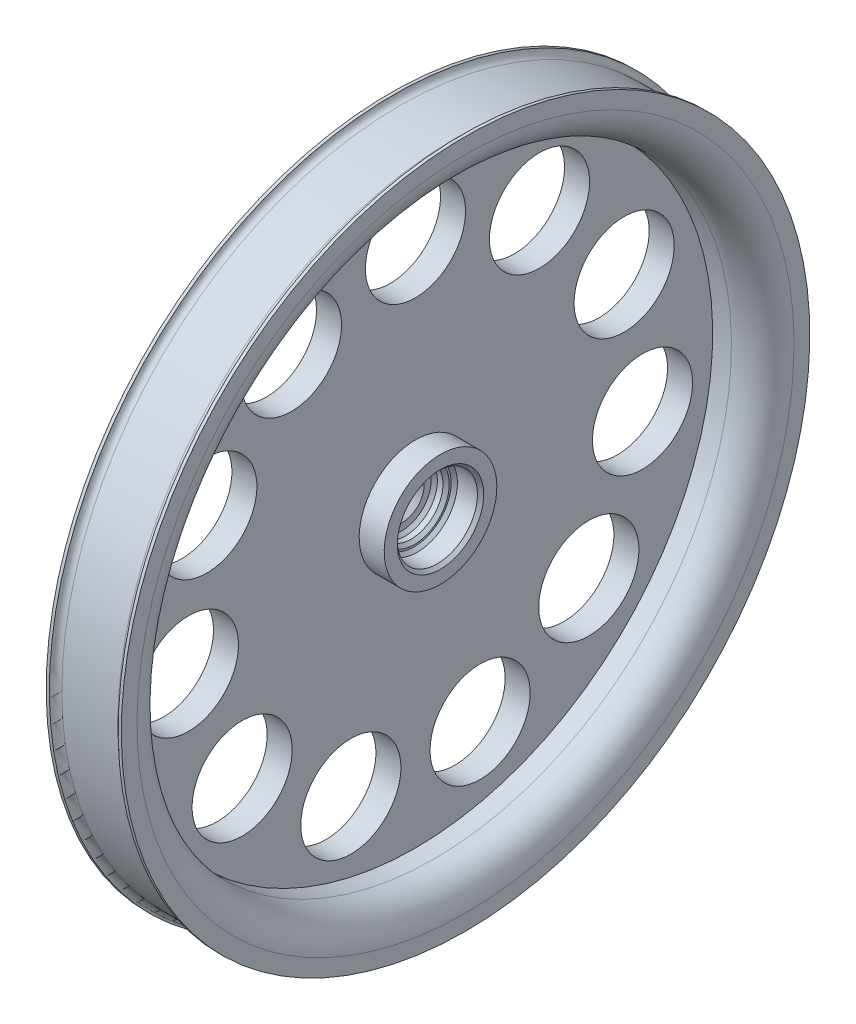
from build123d import *

# Parameters (mm, degrees)
SZKIC2_R                   = 2.5
WYTNIJ_WYCI_GNI_CIE1_DEPTH = 94.523218448
ZAOKR_GLENIE1_R            = 5
ZAOKR_GLENIE2_R            = 5
SFAZOWANIE1_SIZE           = 1
SFAZOWANIE2_SIZE           = 0.5
SFAZOWANIE3_SIZE           = 0.5
SZKIC3_R                   = 8
WYTNIJ_WYCI_GNI_CIE2_DEPTH = 93.122648621


with BuildPart() as part:
    # Szkic1 → Obrót1 (revolve)
    with BuildSketch(Plane.XY):
        with BuildLine():
            Line((0, 37.078244749), (0, 29.562540221))
            Line((0, 29.562540221), (-8, 29.562540221))
            Line((-8, 29.562540221), (-8, -8.921755251))
            Line((-8, -8.921755251), (-4, -8.921755251))
            Line((-4, -8.921755251), (-4, -11.521755251))
            Line((-4, -11.521755251), (-8.2, -11.521755251))
            Line((-8.2, -11.521755251), (-8.2, -12.821755251))
            Line((-8.2, -12.821755251), (-10.1, -12.821755251))
            Line((-10.1, -12.821755251), (-10.1, -17.921755251))
            Line((-10.1, -17.921755251), (-20.1, -17.921755251))
            Line((-20.1, -17.921755251), (-20.1, -4.921755251))
            Line((-20.1, -4.921755251), (-12, 0.007556481))
            Line((-12, 0.007556481), (-12, 37.078244749))
            Line((-12, 37.078244749), (-11.5, 37.078244749))
            ThreePointArc((-11.5, 37.078244749), (-11.207862875, 36.374632586), (-10.504874285, 36.080998091))
            Line((-10.504874285, 36.080998091), (-1.544760665, 36.080998091))
            ThreePointArc((-1.544760665, 36.080998091), (-0.809531736, 36.356631611), (-0.5, 37.078244749))
            Line((-0.5, 37.078244749), (0, 37.078244749))
        make_face()
    revolve(axis=Axis((-20.1, -17.921755251, 0), (1, 0, 0)))

    # Szkic2 → Wytnij-wyciągnięcie1 (cut, through all)
    with BuildSketch(Plane.ZY.offset(20.1)):
        with Locations((0, -17.921755251)):
            Circle(SZKIC2_R)
    extrude(amount=-WYTNIJ_WYCI_GNI_CIE1_DEPTH, mode=Mode.SUBTRACT)

    # Zaokrąglenie1
    zaokr_glenie1_edges = [part.edges().sort_by_distance(p)[0] for p in [
        (-12, -35.851066984, 0),
        (-20.1, -30.921755251, 0),
    ]]
    fillet(zaokr_glenie1_edges, radius=ZAOKR_GLENIE1_R)

    # Zaokrąglenie2
    zaokr_glenie2_edges = [part.edges().sort_by_distance(p)[0] for p in [
        (0, -65.406050724, 0),
    ]]
    fillet(zaokr_glenie2_edges, radius=ZAOKR_GLENIE2_R)

    # Sfazowanie1
    sfazowanie1_edges = [part.edges().sort_by_distance(p)[0] for p in [
        (-10.1, -17.921755251, -2.5),
        (-20.1, -17.921755251, -2.5),
    ]]
    chamfer(sfazowanie1_edges, length=SFAZOWANIE1_SIZE)

    # Sfazowanie2
    sfazowanie2_edges = [part.edges().sort_by_distance(p)[0] for p in [
        (-10.1, -23.021755251, 0),
        (-8.2, -23.021755251, 0),
    ]]
    chamfer(sfazowanie2_edges, length=SFAZOWANIE2_SIZE)

    # Sfazowanie3
    sfazowanie3_edges = [part.edges().sort_by_distance(p)[0] for p in [
        (-8.2, -24.321755251, 0),
        (-4, -24.321755251, 0),
    ]]
    chamfer(sfazowanie3_edges, length=SFAZOWANIE3_SIZE)

    # Szkic3 → Wytnij-wyciągnięcie2 (cut, through all)
    with BuildSketch(Plane.ZY.offset(12)):
        with Locations((0, 18.725413739)):
            Circle(SZKIC3_R)
        with Locations((19.8129554, 12.90780513)):
            Circle(SZKIC3_R)
        with Locations((33.335437453, -2.697971069)):
            Circle(SZKIC3_R)
        with Locations((36.274153651, -23.137191179)):
            Circle(SZKIC3_R)
        with Locations((27.696082366, -41.920547233)):
            Circle(SZKIC3_R)
        with Locations((10.324700621, -53.0844564)):
            Circle(SZKIC3_R)
        with Locations((-10.324700621, -53.0844564)):
            Circle(SZKIC3_R)
        with Locations((-27.696082366, -41.920547233)):
            Circle(SZKIC3_R)
        with Locations((-36.274153651, -23.137191179)):
            Circle(SZKIC3_R)
        with Locations((-33.335437453, -2.697971069)):
            Circle(SZKIC3_R)
        with Locations((-19.8129554, 12.90780513)):
            Circle(SZKIC3_R)
    extrude(amount=-WYTNIJ_WYCI_GNI_CIE2_DEPTH, mode=Mode.SUBTRACT)


solid = part.part
